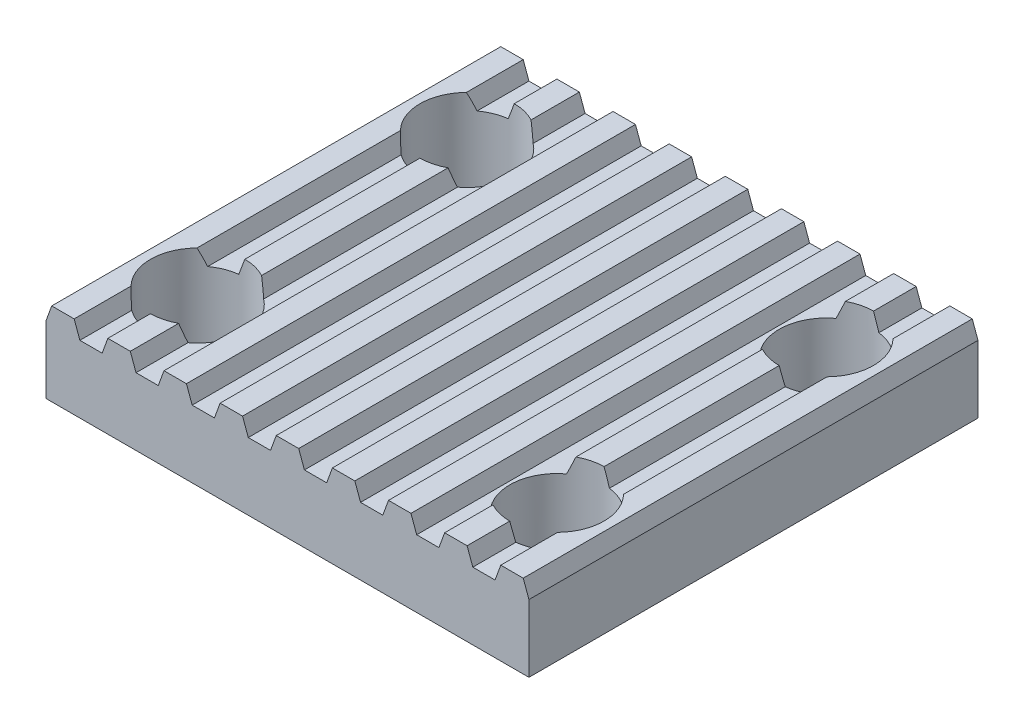
from build123d import *

# Parameters (mm, degrees)
BOSS_EXTRUDE1_DEPTH = 10
SKETCH2_R           = 2.1
CUT_EXTRUDE1_DEPTH  = 16.144480013


with BuildPart() as part:
    # Sketch1 → Boss-Extrude1 (new, symmetric)
    with BuildSketch(Plane.XY):
        Polygon((-10.754779164, 1.5), (-10.5, 2.2), (-9.5, 2.2), (-9.245220836, 1.5), (-8.254779164, 1.5), (-8, 2.2), (-7, 2.2), (-6.745220836, 1.5), (-5.754779164, 1.5), (-5.5, 2.2), (-4.5, 2.2), (-4.245220836, 1.5), (-3.254779164, 1.5), (-3, 2.2), (-2, 2.2), (-1.745220836, 1.5), (-0.754779164, 1.5), (-0.5, 2.2), (0.5, 2.2), (0.754779164, 1.5), (1.745220836, 1.5), (2, 2.2), (3, 2.2), (3.254779164, 1.5), (4.245220836, 1.5), (4.5, 2.2), (5.5, 2.2), (5.754779164, 1.5), (6.745220836, 1.5), (7, 2.2), (8, 2.2), (8.254779164, 1.5), (9.245220836, 1.5), (9.5, 2.2), (10.5, 2.2), (10.754779164, 1.5), (10.754779164, -1.5), (-10.754779164, -1.5), align=None)
    extrude(amount=BOSS_EXTRUDE1_DEPTH, both=True)

    # Sketch2 → Cut-Extrude1 (cut, through all)
    with BuildSketch(Plane.XZ.offset(1.5)):
        with Locations((-8, -6)):
            Circle(SKETCH2_R)
        with Locations((8, -6)):
            Circle(SKETCH2_R)
        with Locations((8, 6)):
            Circle(SKETCH2_R)
        with Locations((-8, 6)):
            Circle(SKETCH2_R)
    extrude(amount=-CUT_EXTRUDE1_DEPTH, mode=Mode.SUBTRACT)


solid = part.part
